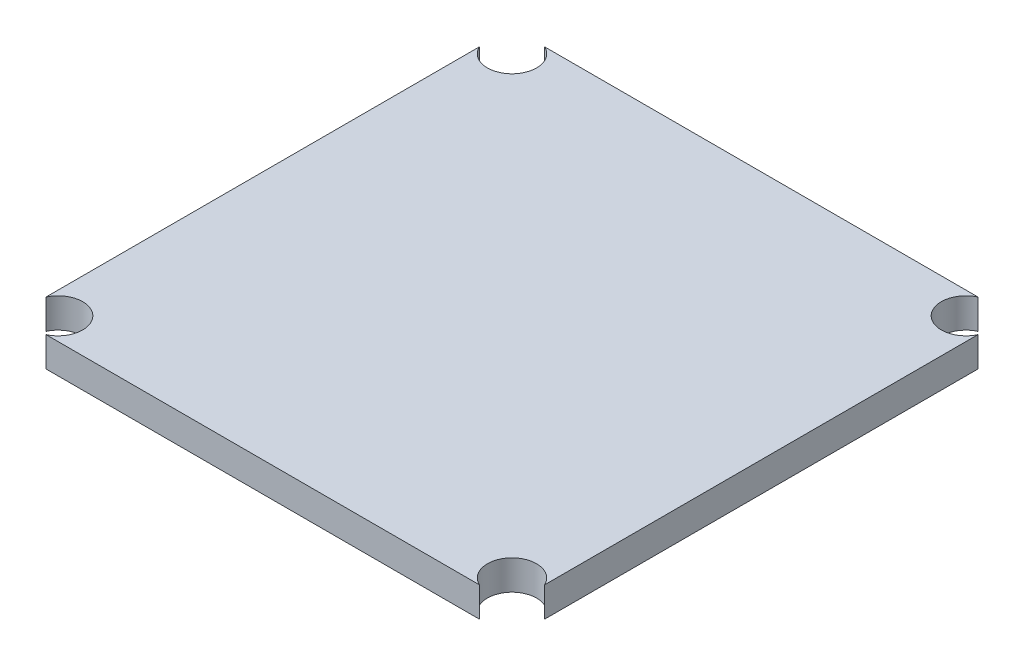
from build123d import *

# Parameters (mm, degrees)
SKETCH2_W             = 33.5
SKETCH2_H             = 33.5
BOSS_EXTRUDE1_DEPTH   = 2
M4_TAPPED_HOLE1_DEPTH = 2


# Read off the part's stored shape, not the designer's step: M4 Tapped Hole1
with BuildPart() as part:
    # Sketch2 → Boss-Extrude1 (new body)
    with BuildSketch(Plane(origin=(0, 0, 0), x_dir=(1, 0, 0), z_dir=(0, 1, 0))):
        Rectangle(SKETCH2_W, SKETCH2_H)
    extrude(amount=BOSS_EXTRUDE1_DEPTH)

    # M4 Tapped Hole1 outline → M4 Tapped Hole1 (cut)
    with BuildSketch(Plane(origin=(0, 0, 0), x_dir=(1, 0, 0), z_dir=(0, 1, 0))):
        with BuildLine():
            Line((16.75, -16.75), (16.75, -14.562613646))
            ThreePointArc((16.75, -14.562613646), (14.083273811, -14.083273811), (14.562613646, -16.75))
            Line((14.562613646, -16.75), (16.75, -16.75))
        make_face()
        with BuildLine():
            ThreePointArc((14.562613646, 16.75), (14.083273811, 14.083273811), (16.75, 14.562613646))
            Line((16.75, 14.562613646), (16.75, 16.75))
            Line((16.75, 16.75), (14.562613646, 16.75))
        make_face()
        with BuildLine():
            Line((-16.75, -16.75), (-14.562613646, -16.75))
            ThreePointArc((-14.562613646, -16.75), (-14.083273811, -14.083273811), (-16.75, -14.562613646))
            Line((-16.75, -14.562613646), (-16.75, -16.75))
        make_face()
        with BuildLine():
            ThreePointArc((-16.75, 14.562613646), (-14.083273811, 14.083273811), (-14.562613646, 16.75))
            Line((-14.562613646, 16.75), (-16.75, 16.75))
            Line((-16.75, 16.75), (-16.75, 14.562613646))
        make_face()
    extrude(amount=M4_TAPPED_HOLE1_DEPTH, mode=Mode.SUBTRACT)


solid = part.part
